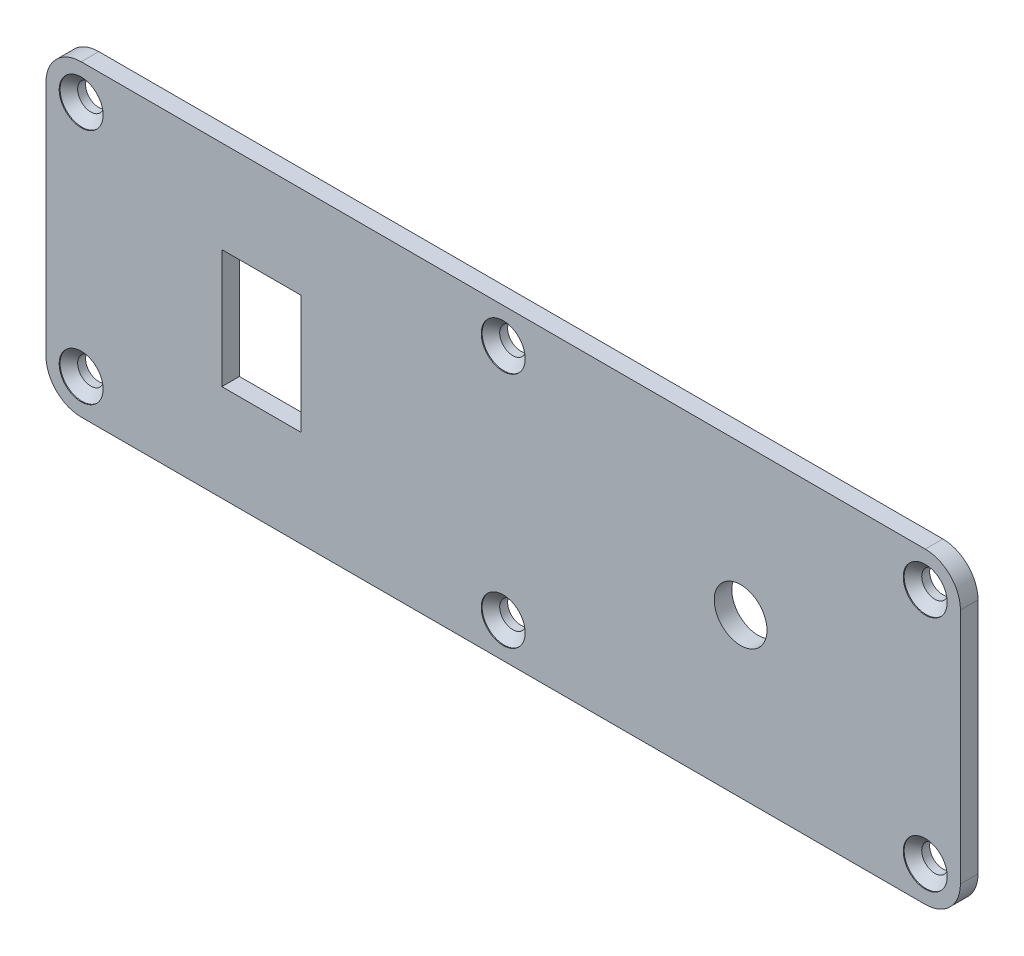
from build123d import *

# Parameters (mm, degrees)
IZIM1_W                     = 104
IZIM1_H                     = 35
Y_KSEKLIK_EKSTR_ZYON1_DEPTH = 2
IZIM2_R                     = 1.5
KES_EKSTR_ZYON1_DEPTH       = 2
IZIM3_R                     = 2.5
KES_EKSTR_ZYON2_DEPTH       = 0.1
PAH2_SIZE                   = 1
IZIM4_R                     = 1.5
KES_EKSTR_ZYON3_DEPTH       = 2
IZIM5_R                     = 2.5
KES_EKSTR_ZYON4_DEPTH       = 0.1
PAH3_SIZE                   = 1
RADYUS1_R                   = 4
IZIM7_R                     = 3
IZIM7_W                     = 9
IZIM7_H                     = 13.5
KES_EKSTR_ZYON6_DEPTH       = 2


with BuildPart() as part:
    # Çizim1 → Yükseklik-Ekstrüzyon1 (new body)
    with BuildSketch(Plane.XY):
        with Locations((-52, 17.5)):
            Rectangle(IZIM1_W, IZIM1_H)
    extrude(amount=Y_KSEKLIK_EKSTR_ZYON1_DEPTH)

    # Çizim2 → Kes-Ekstrüzyon1 (cut)
    with BuildSketch(Plane.XY.offset(2)):
        with Locations((-100, 31)):
            Circle(IZIM2_R)
        with Locations((-100, 4)):
            Circle(IZIM2_R)
        with Locations(Location((-4, 4, 0), (0, 0, 180))):
            Circle(IZIM2_R)
        with Locations(Location((-4, 31, 0), (0, 0, 180))):
            Circle(IZIM2_R)
    extrude(amount=-KES_EKSTR_ZYON1_DEPTH, mode=Mode.SUBTRACT)

    # Çizim3 → Kes-Ekstrüzyon2 (cut)
    with BuildSketch(Plane.XY.offset(2)):
        with Locations((-100, 31)):
            Circle(IZIM3_R)
        with Locations((-100, 4)):
            Circle(IZIM3_R)
        with Locations(Location((-4, 4, 0), (0, 0, 180))):
            Circle(IZIM3_R)
        with Locations(Location((-4, 31, 0), (0, 0, 180))):
            Circle(IZIM3_R)
    extrude(amount=-KES_EKSTR_ZYON2_DEPTH, mode=Mode.SUBTRACT)

    # Pah2
    pah2_edges = [part.edges().sort_by_distance(p)[0] for p in [
        (-2.5, 31, 1.9),
        (-2.5, 4, 1.9),
        (-101.5, 4, 1.9),
        (-101.5, 31, 1.9),
    ]]
    chamfer(pah2_edges, length=PAH2_SIZE - 0.0001)  # a hair under: the kernel refuses the full size

    # Çizim4 → Kes-Ekstrüzyon3 (cut)
    with BuildSketch(Plane.XY.offset(2)):
        with Locations((-52, 31)):
            Circle(IZIM4_R)
        with Locations((-52, 4)):
            Circle(IZIM4_R)
    extrude(amount=-KES_EKSTR_ZYON3_DEPTH, mode=Mode.SUBTRACT)

    # Çizim5 → Kes-Ekstrüzyon4 (cut)
    with BuildSketch(Plane.XY.offset(2)):
        with Locations((-52, 31)):
            Circle(IZIM5_R)
        with Locations((-52, 4)):
            Circle(IZIM5_R)
    extrude(amount=-KES_EKSTR_ZYON4_DEPTH, mode=Mode.SUBTRACT)

    # Pah3
    pah3_edges = [part.edges().sort_by_distance(p)[0] for p in [
        (-53.5, 31, 1.9),
        (-53.5, 4, 1.9),
    ]]
    chamfer(pah3_edges, length=PAH3_SIZE - 0.0001)  # a hair under: the kernel refuses the full size

    # Radyus1
    radyus1_edges = [part.edges().sort_by_distance(p)[0] for p in [
        (0, 0, 1),
        (-104, 0, 1),
        (-104, 35, 1),
        (0, 35, 1),
    ]]
    fillet(radyus1_edges, radius=RADYUS1_R)

    # Çizim7 → Kes-Ekstrüzyon6 (cut)
    with BuildSketch(Plane.XY.offset(2)):
        with Locations((-25, 18)):
            Circle(IZIM7_R)
        with Locations((-79.5, 17.75)):
            Rectangle(IZIM7_W, IZIM7_H)
    extrude(amount=-KES_EKSTR_ZYON6_DEPTH, mode=Mode.SUBTRACT)


solid = part.part
